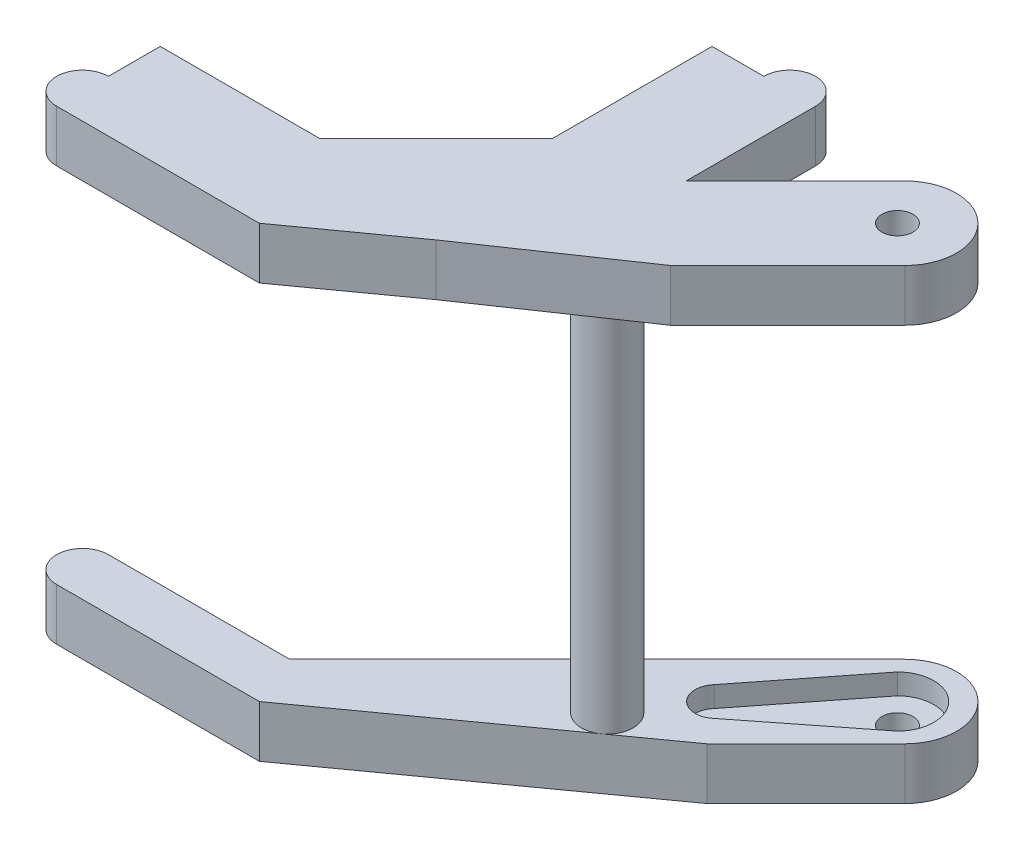
from build123d import *

# Parameters (mm, degrees)
AUFSATZ_LINEAR_AUSTRAGEN1_DEPTH  = 5
VERRUNDUNG1_RADIUS               = 2.5
VERRUNDUNG1_LENGTH               = 5
SKIZZE6_W                        = 37
SKIZZE6_H                        = 5
AUFSATZ_LINEAR_AUSTRAGEN3_DEPTH  = 5
SCHNITT_LINEAR_AUSTRAGEN3_DEPTH  = 5
AUFSATZ_LINEAR_AUSTRAGEN6_DEPTH  = 5
SCHNITT_LINEAR_AUSTRAGEN2_DEPTH  = 2
VERRUNDUNG8_RADIUS               = 2.5
VERRUNDUNG8_LENGTH               = 5
VERRUNDUNG9_RADIUS               = 5
VERRUNDUNG9_LENGTH               = 5
SKIZZE37_R                       = 2.5
AUFSATZ_LINEAR_AUSTRAGEN11_DEPTH = 35
SPIEGELN19_START                 = 40
SPIEGELN19_DEPTH                 = 5
SCHNITT_LINEAR_AUSTRAGEN4_DEPTH  = 5
SKIZZE39_W                       = 20
SKIZZE39_H                       = 5
AUFSATZ_LINEAR_AUSTRAGEN12_DEPTH = 5
SKIZZE40_W                       = 17.5
SKIZZE40_H                       = 5
AUFSATZ_LINEAR_AUSTRAGEN14_DEPTH = 5
SKIZZE41_W                       = 17.5
SKIZZE41_H                       = 5
AUFSATZ_LINEAR_AUSTRAGEN15_DEPTH = 5
FASE10_SIZE                      = 5
SKIZZE42_R                       = 1.5
SCHNITT_LINEAR_AUSTRAGEN6_DEPTH  = 127.435665063
SCHNITT_LINEAR_AUSTRAGEN7_DEPTH  = 5


# Read off the part's stored shape, not the designer's step: Spiegeln19
with BuildPart() as part:
    # Skizze2 → Aufsatz-Linear austragen1 (new body)
    with BuildSketch(Plane(origin=(0, 0, 0), x_dir=(1, 0, 0), z_dir=(0, 1, 0))):
        Polygon((-81.170751107, 25.766558824), (-76.170751107, 25.766558824), (-76.170751107, 3.695491012), (-93.241818919, -13.3755768), (-115.312886731, -13.3755768), (-115.312886731, -8.3755768), (-95.312886731, -8.3755768), (-81.170751107, 5.766558824), align=None)
    extrude(amount=AUFSATZ_LINEAR_AUSTRAGEN1_DEPTH)

    # Verrundung1: full round fillet: the end face becomes a half cylinder, R = half its width
    verrundung1_face = Plane((-115.312886731, 2.5, 10.8755768), x_dir=(0, 1, 0), z_dir=(-1, 0, 0))  # on the end face: x along it, z out of the body
    verrundung1_slab = verrundung1_face.offset(-VERRUNDUNG1_RADIUS / 2) * Box(VERRUNDUNG1_LENGTH, 2 * VERRUNDUNG1_RADIUS, VERRUNDUNG1_RADIUS, mode=Mode.PRIVATE)  # the body's end, R deep
    verrundung1_round = Plane((-112.812886731, 2.5, 10.8755768), x_dir=(-1, 0, 0), z_dir=(0, 1, 0)) * Cylinder(VERRUNDUNG1_RADIUS, VERRUNDUNG1_LENGTH, mode=Mode.PRIVATE)  # its axis R under the face
    add(verrundung1_slab - verrundung1_round, mode=Mode.SUBTRACT)

    # Skizze6 → Aufsatz-Linear austragen3 (add, symmetric)
    with BuildSketch(Plane(origin=(-39.933121059, 0, -39.933121059), x_dir=(0.7071067811865485, 0, -0.7071067811865467), z_dir=(0.7071067811865467, 0, 0.7071067811865485))):
        with Locations((-44.818815693, 2.5)):
            Rectangle(SKIZZE6_W, SKIZZE6_H)
    extrude(amount=AUFSATZ_LINEAR_AUSTRAGEN3_DEPTH, both=True)

    # Skizze10 → Schnitt-Linear austragen3 (cut)
    with BuildSketch(Plane.XZ):
        Polygon((-84.706285013, 4.840042894), (-68.089275655, -4.705898652), (-81.170751107, 8.3755768), align=None)
    extrude(amount=-SCHNITT_LINEAR_AUSTRAGEN3_DEPTH, mode=Mode.SUBTRACT)

    # Skizze15 → Aufsatz-Linear austragen6 (add)
    with BuildSketch(Plane.XZ):
        Polygon((-93.241818919, 13.3755768), (-68.089275655, -4.705898652), (-84.706285013, 4.840042894), align=None)
    extrude(amount=-AUFSATZ_LINEAR_AUSTRAGEN6_DEPTH)

    # Skizze9 → Schnitt-Linear austragen2 (cut)
    with BuildSketch(Plane(origin=(0, 5, 0), x_dir=(1, 0, 0), z_dir=(0, 1, 0))):
        with BuildLine():
            Line((-64.90729514, 19.908694448), (-72.710166677, 9.977325168))
            ThreePointArc((-72.710166677, 9.977325168), (-72.613070241, 7.253171877), (-69.888916951, 7.156075442))
            Line((-69.888916951, 7.156075442), (-59.957547671, 14.958946979))
            ThreePointArc((-59.957547671, 14.958946979), (-59.957547671, 19.908694448), (-64.90729514, 19.908694448))
        make_face()
    extrude(amount=-SCHNITT_LINEAR_AUSTRAGEN2_DEPTH, mode=Mode.SUBTRACT)

    # Verrundung8: full round fillet: the end face becomes a half cylinder, R = half its width
    verrundung8_face = Plane((-78.670751107, 2.5, -25.766558824), x_dir=(0, 1, 0), z_dir=(0, 0, -1))  # on the end face: x along it, z out of the body
    verrundung8_slab = verrundung8_face.offset(-VERRUNDUNG8_RADIUS / 2) * Box(VERRUNDUNG8_LENGTH, 2 * VERRUNDUNG8_RADIUS, VERRUNDUNG8_RADIUS, mode=Mode.PRIVATE)  # the body's end, R deep
    verrundung8_round = Plane((-78.670751107, 2.5, -23.266558824), x_dir=(0, 0, -1), z_dir=(0, 1, 0)) * Cylinder(VERRUNDUNG8_RADIUS, VERRUNDUNG8_LENGTH, mode=Mode.PRIVATE)  # its axis R under the face
    add(verrundung8_slab - verrundung8_round, mode=Mode.SUBTRACT)

    # Verrundung9: full round fillet: the end face becomes a half cylinder, R = half its width
    verrundung9_face = Plane((-58.543334109, 2.5, -21.32290801), x_dir=(0, 1, 0), z_dir=(0.707106781187, 0, -0.707106781187))  # on the end face: x along it, z out of the body
    verrundung9_slab = verrundung9_face.offset(-VERRUNDUNG9_RADIUS / 2) * Box(VERRUNDUNG9_LENGTH, 2 * VERRUNDUNG9_RADIUS, VERRUNDUNG9_RADIUS, mode=Mode.PRIVATE)  # the body's end, R deep
    verrundung9_round = Plane((-62.078868015, 2.5, -17.787374104), x_dir=(0.707106781187, 0, -0.707106781187), z_dir=(0, 1, 0)) * Cylinder(VERRUNDUNG9_RADIUS, VERRUNDUNG9_LENGTH, mode=Mode.PRIVATE)  # its axis R under the face
    add(verrundung9_slab - verrundung9_round, mode=Mode.SUBTRACT)

    # Skizze37 → Aufsatz-Linear austragen11 (add)
    with BuildSketch(Plane(origin=(0, 5, 0), x_dir=(1, 0, 0), z_dir=(0, 1, 0))):
        with Locations(Location((-75.486500657, 2.467174327, 0), (0, 0, 305.711324765))):
            Circle(SKIZZE37_R)
    extrude(amount=AUFSATZ_LINEAR_AUSTRAGEN11_DEPTH)

    # Spiegeln19 outline → Spiegeln19 (add)
    with BuildSketch(Plane(origin=(0, 0, 0), x_dir=(1, 0, 0), z_dir=(0, 1, 0)).offset(SPIEGELN19_START)):
        with BuildLine():
            ThreePointArc((-58.543334109, 14.251840198), (-58.543334109, 21.32290801), (-65.614401921, 21.32290801))
            Line((-65.614401921, 21.32290801), (-76.170751107, 10.766558824))
            Line((-76.170751107, 10.766558824), (-76.170751107, 23.266558824))
            ThreePointArc((-76.170751107, 23.266558824), (-78.670751107, 25.766558824), (-81.170751107, 23.266558824))
            Line((-81.170751107, 23.266558824), (-81.170751107, 5.766558824))
            Line((-81.170751107, 5.766558824), (-95.312886731, -8.3755768))
            Line((-95.312886731, -8.3755768), (-112.812886731, -8.3755768))
            ThreePointArc((-112.812886731, -8.3755768), (-115.312886731, -10.8755768), (-112.812886731, -13.3755768))
            Line((-112.812886731, -13.3755768), (-93.241818919, -13.3755768))
            Line((-93.241818919, -13.3755768), (-83.310270003, -6.236057904))
            Line((-83.310270003, -6.236057904), (-81.170751107, -8.3755768))
            Line((-81.170751107, -8.3755768), (-58.543334109, 14.251840198))
        make_face()
    extrude(amount=SPIEGELN19_DEPTH)

    # Skizze38 → Schnitt-Linear austragen4 (cut)
    with BuildSketch(Plane(origin=(0, 45, 0), x_dir=(1, 0, 0), z_dir=(0, 1, 0))):
        Polygon((-83.310270003, -6.236057904), (-69.857042608, 2.938131699), (-81.170751107, -8.3755768), align=None)
    extrude(amount=-SCHNITT_LINEAR_AUSTRAGEN4_DEPTH, mode=Mode.SUBTRACT)

    # Skizze39 → Aufsatz-Linear austragen12 (add)
    with BuildSketch(Plane(origin=(-43.468654965, 0, -43.468654965), x_dir=(-0.7071067811865486, 0, 0.7071067811865465), z_dir=(-0.7071067811865465, 0, -0.7071067811865486))):
        with Locations((63.318815693, 42.5)):
            Rectangle(SKIZZE39_W, SKIZZE39_H)
    extrude(amount=AUFSATZ_LINEAR_AUSTRAGEN12_DEPTH)

    # Skizze40 → Aufsatz-Linear austragen14 (add)
    with BuildSketch(Plane.ZY.offset(81.170751107)):
        with Locations((-14.516558824, 42.5)):
            Rectangle(SKIZZE40_W, SKIZZE40_H)
    extrude(amount=AUFSATZ_LINEAR_AUSTRAGEN14_DEPTH)

    # Skizze41 → Aufsatz-Linear austragen15 (add)
    with BuildSketch(Plane(origin=(0, 0, 8.3755768), x_dir=(-1, 0, 0), z_dir=(0, 0, -1))):
        with Locations((104.062886731, 42.5)):
            Rectangle(SKIZZE41_W, SKIZZE41_H)
    extrude(amount=AUFSATZ_LINEAR_AUSTRAGEN15_DEPTH)

    # Fase10
    fase10_edges = [part.edges().sort_by_distance(p)[0] for p in [
        (-86.170751107, 40, -15.55209273),
        (-91.777352825, 40, -2.231024918),
        (-105.098420637, 40, 3.3755768),
    ]]
    chamfer(fase10_edges, length=FASE10_SIZE - 0.0001)  # a hair under: the kernel refuses the full size

    # Skizze42 → Schnitt-Linear austragen6 (cut, through all)
    with BuildSketch(Plane.XZ):
        with Locations(Location((-62.432421405, -17.433820713, 0), (0, 0, 270))):
            Circle(SKIZZE42_R)
    extrude(amount=-SCHNITT_LINEAR_AUSTRAGEN6_DEPTH, mode=Mode.SUBTRACT)

    # Skizze43 → Schnitt-Linear austragen7 (cut)
    with BuildSketch(Plane(origin=(0, 0, 0), x_dir=(-1, 0, 0), z_dir=(0, -1, 0))):
        Polygon((81.170751107, 5.766558824), (76.170751107, 10.766558824), (76.170751107, 25.766558824), (81.170751107, 25.766558824), align=None)
    extrude(amount=-SCHNITT_LINEAR_AUSTRAGEN7_DEPTH, mode=Mode.SUBTRACT)


solid = part.part
